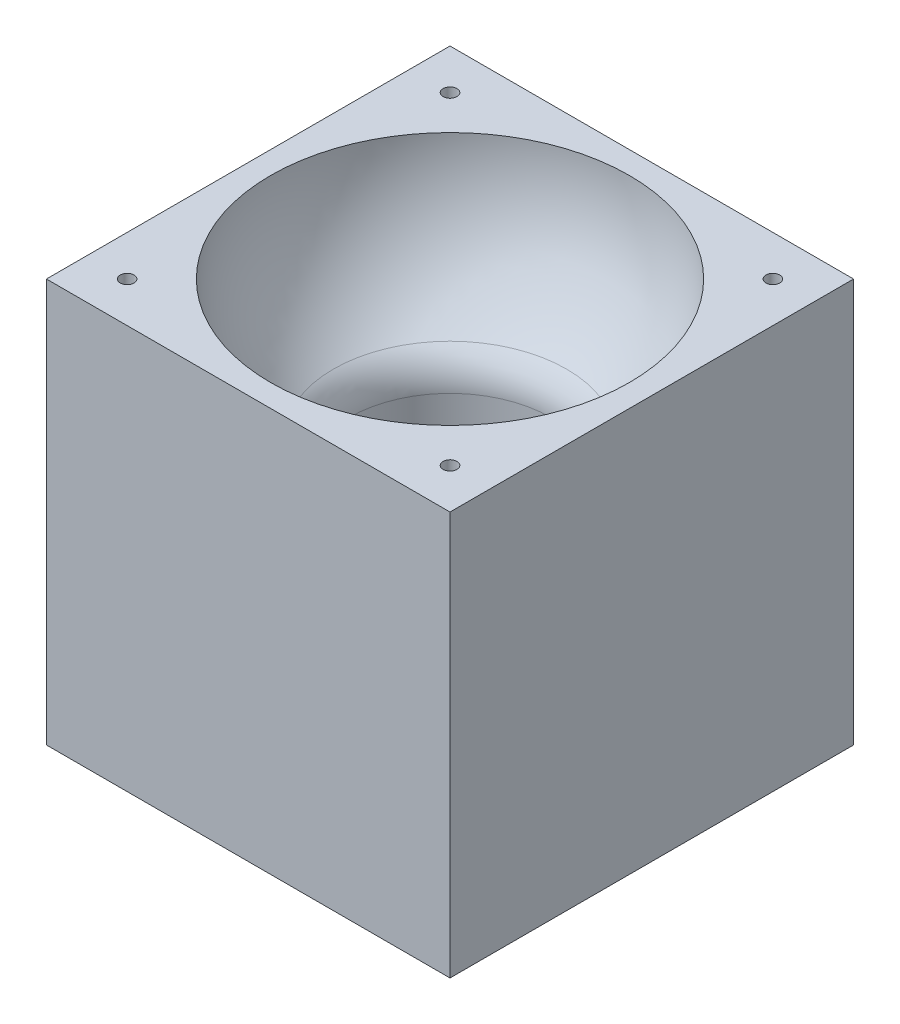
from build123d import *
from build123d.topology import SkipClean

# Parameters (mm, degrees)
SKETCH1_W                           = 114.3
SKETCH1_H                           = 114.3
BOSS_EXTRUDE1_DEPTH                 = 114.3
SKETCH3_R                           = 28.575
CUT_EXTRUDE1_DEPTH                  = 107.95
SKETCH4_R                           = 19.3675
CUT_EXTRUDE2_DEPTH                  = 195.376394
SHELL1_OUTLINE_W                    = 101.6
SHELL1_OUTLINE_H                    = 101.6
SHELL1_OUTLINE_R                    = 34.925
SHELL1_DEPTH                        = 69.063213
SHELL1_START                        = 69.063213
SHELL1_2_OUTLINE_W                  = 101.6
SHELL1_2_OUTLINE_H                  = 101.6
SHELL1_2_DEPTH                      = 38.886787
FILLET2_R                           = 3.81
CUT_EXTRUDE4_REACH                  = 173.45
CUT_EXTRUDE4_END_RADIUS             = 34.925
SKETCH8_R                           = 9.525
CUT_EXTRUDE4_DIRECTION_2_REACH      = 173.45
CUT_EXTRUDE4_DIRECTION_2_END_RADIUS = 34.925
SKETCH9_R                           = 1.9685
CUT_EXTRUDE5_DEPTH                  = 198.973407
CIRPATTERN1_COUNT                   = 4
CIRPATTERN1_ANGLE                   = 135
CUT_EXTRUDE7_DEPTH                  = 3.175
FILLET3_R                           = 12.7


with BuildPart() as part:
    # Sketch1 → Boss-Extrude1 (new body)
    with BuildSketch(Plane(origin=(0, 0, 0), x_dir=(1, 0, 0), z_dir=(0, 1, 0))):
        with Locations((57.15, 57.15)):
            Rectangle(SKETCH1_W, SKETCH1_H)
    extrude(amount=BOSS_EXTRUDE1_DEPTH)

    # Sketch2 → Cut-Revolve1 (revolve, cut)
    with BuildSketch(Plane(origin=(0, 114.3, 0), x_dir=(1, 0, 0), z_dir=(0, 1, 0))):
        with BuildLine():
            Line((57.15, 107.95), (57.15, 6.35))
            ThreePointArc((57.15, 6.35), (6.35, 57.15), (57.15, 107.95))
        make_face()
    revolve(axis=Axis((57.15, 114.3, 0), (0, 0, -1)), mode=Mode.SUBTRACT)

    # Sketch3 → Cut-Extrude1 (cut)
    with BuildSketch(Plane(origin=(0, 114.3, 0), x_dir=(1, 0, 0), z_dir=(0, 1, 0))):
        with Locations(Location((57.15, 57.15, 0), (0, 0, 270))):
            Circle(SKETCH3_R)
    extrude(amount=-CUT_EXTRUDE1_DEPTH, mode=Mode.SUBTRACT)

    # Sketch4 → Cut-Extrude2 (cut, through all)
    with BuildSketch(Plane(origin=(0, 6.35, 0), x_dir=(1, 0, 0), z_dir=(0, 1, 0))):
        with Locations(Location((57.15, 57.15, 0), (0, 0, 270))):
            Circle(SKETCH4_R)
    extrude(amount=-CUT_EXTRUDE2_DEPTH, mode=Mode.SUBTRACT)

    # Shell1: read off the stored shape, not the designer's step
    # Shell1 outline → Shell1 (cut)
    with BuildSketch(Plane(origin=(0, 0, 0), x_dir=(1, 0, 0), z_dir=(0, 1, 0))):
        with Locations((57.15, 57.15)):
            Rectangle(SHELL1_OUTLINE_W, SHELL1_OUTLINE_H)
        with Locations((57.15, 57.15)):
            Circle(SHELL1_OUTLINE_R, mode=Mode.SUBTRACT)
    extrude(amount=SHELL1_DEPTH, mode=Mode.SUBTRACT)

    # Shell1 2 outline → Shell1 2 (cut)
    with BuildSketch(Plane(origin=(0, 0, 0), x_dir=(1, 0, 0), z_dir=(0, 1, 0)).offset(SHELL1_START)):
        with Locations((57.15, 57.15)):
            Rectangle(SHELL1_2_OUTLINE_W, SHELL1_2_OUTLINE_H)
    extrude(amount=SHELL1_2_DEPTH, mode=Mode.SUBTRACT)

    # Shell1 3 outline → Shell1 3 (revolve)
    with SkipClean():  # the faces are left unmerged after this step: merging them gives an invalid solid
        with BuildSketch(Plane(origin=(57.15, 0, -57.15), x_dir=(1, 0, 0), z_dir=(0, 0, 1))):
            with BuildLine():
                ThreePointArc((50.401562, 107.95), (43.32526, 87.77526), (28.575, 72.298698))
                Line((28.575, 72.298698), (28.575, 69.063213))
                Line((28.575, 69.063213), (34.925, 69.063213))
                ThreePointArc((34.925, 69.063213), (49.812015, 86.284189), (56.796127, 107.95))
                Line((56.796127, 107.95), (50.401562, 107.95))
            make_face()
        revolve(axis=Axis((57.15, 0, -57.15), (0, 1, 0)))

    # Fillet2
    fillet2_edges = [part.edges().sort_by_distance(p)[0] for p in [
        (22.225, 0, -57.15),
        (22.225, 69.063213, -57.15),
    ]]
    fillet(fillet2_edges, radius=FILLET2_R)

    # Cut-Extrude4: up to this cylinder (the profile starts inside it)
    with SkipClean():  # the faces are left unmerged after this step: merging them gives an invalid solid
        cut_extrude4_end = Plane(origin=(57.15, 33.974309, -57.15), z_dir=(0, 1, 0)) * Cylinder(CUT_EXTRUDE4_END_RADIUS, 417.75, mode=Mode.PRIVATE)
        # Sketch8 → Cut-Extrude4 (cut, up to the surface)
        with BuildSketch(Plane.XY.offset(-57.15), mode=Mode.PRIVATE) as cut_extrude4_sk1:
            with Locations((57.15, 33.974309)):
                Circle(SKETCH8_R)
        cut_extrude4_tool1 = extrude(cut_extrude4_sk1.sketch, amount=-CUT_EXTRUDE4_REACH, mode=Mode.PRIVATE) & cut_extrude4_end
        cut_extrude4 = cut_extrude4_tool1.solids().sort_by_distance((57.15, 33.974309, -57.15))[0]
        add(cut_extrude4, mode=Mode.SUBTRACT)

    # Cut-Extrude4 direction 2: up to this cylinder (the profile starts inside it)
    with SkipClean():  # the faces are left unmerged after this step: merging them gives an invalid solid
        cut_extrude4_direction_2_end = Plane(origin=(57.15, 33.974309, -57.15), z_dir=(0, 1, 0)) * Cylinder(CUT_EXTRUDE4_DIRECTION_2_END_RADIUS, 417.75, mode=Mode.PRIVATE)
        # Sketch8 → Cut-Extrude4 direction 2 (cut, up to the surface)
        with BuildSketch(Plane.XY.offset(-57.15), mode=Mode.PRIVATE) as cut_extrude4_direction_2_sk1:
            with Locations((57.15, 33.974309)):
                Circle(SKETCH8_R)
        cut_extrude4_direction_2_tool1 = extrude(cut_extrude4_direction_2_sk1.sketch, amount=CUT_EXTRUDE4_DIRECTION_2_REACH, mode=Mode.PRIVATE) & cut_extrude4_direction_2_end
        cut_extrude4_direction_2 = cut_extrude4_direction_2_tool1.solids().sort_by_distance((57.15, 33.974309, -57.15))[0]
        add(cut_extrude4_direction_2, mode=Mode.SUBTRACT)
        cut_extrude4 = cut_extrude4 + cut_extrude4_direction_2  # both directions under the feature's name, for the pattern or mirror that repeats it

    # Sketch9 → Cut-Extrude5 (cut, through all)
    with SkipClean():  # the faces are left unmerged after this step: merging them gives an invalid solid
        with BuildSketch(Plane(origin=(0, 114.3, 0), x_dir=(1, 0, 0), z_dir=(0, 1, 0))):
            with Locations(Location((11.43, 102.87, 0), (0, 0, 270))):
                Circle(SKETCH9_R)
            with Locations(Location((102.87, 102.87, 0), (0, 0, 270))):
                Circle(SKETCH9_R)
            with Locations(Location((102.87, 11.43, 0), (0, 0, 270))):
                Circle(SKETCH9_R)
            with Locations(Location((11.43, 11.43, 0), (0, 0, 270))):
                Circle(SKETCH9_R)
        extrude(amount=-CUT_EXTRUDE5_DEPTH, mode=Mode.SUBTRACT)

    # CirPattern1: Cut-Extrude4 ×4 about axis
    with SkipClean():  # the faces are left unmerged after this step: merging them gives an invalid solid
        cirpattern1_axis = Axis((57.15, 6.35, -57.15), (0, 1, 0))
        for i in range(1, CIRPATTERN1_COUNT):
            add(cut_extrude4.rotate(cirpattern1_axis, i * CIRPATTERN1_ANGLE / (CIRPATTERN1_COUNT - 1)), mode=Mode.SUBTRACT)

    # Sketch12 → Cut-Extrude7 (cut)
    with SkipClean():  # the faces are left unmerged after this step: merging them gives an invalid solid
        with BuildSketch(Plane.XZ.offset(-107.95)):
            Polygon((106.635769, -104.093263), (105.812262, -100.22038), (102.046493, -98.997117), (99.104231, -101.646737), (99.927738, -105.51962), (103.693507, -106.742883), align=None)
            Polygon((14.333389, -105.562159), (15.213173, -101.701671), (12.309784, -99.009512), (8.526611, -100.177841), (7.646827, -104.038329), (10.550216, -106.730488), align=None)
            Polygon((14.333389, -8.737841), (10.550216, -7.569512), (7.646827, -10.261671), (8.526611, -14.122159), (12.309784, -15.290488), (15.213173, -12.598329), align=None)
            Polygon((106.635769, -10.206737), (103.693507, -7.557117), (99.927738, -8.78038), (99.104231, -12.653263), (102.046493, -15.302883), (105.812262, -14.07962), align=None)
        extrude(amount=-CUT_EXTRUDE7_DEPTH, mode=Mode.SUBTRACT)

    # Fillet3
    fillet3_edges = [part.edges().sort_by_distance(p)[0] for p in [
        (28.575, 72.298698, -57.15),
    ]]
    fillet(fillet3_edges, radius=FILLET3_R)


solid = part.part
